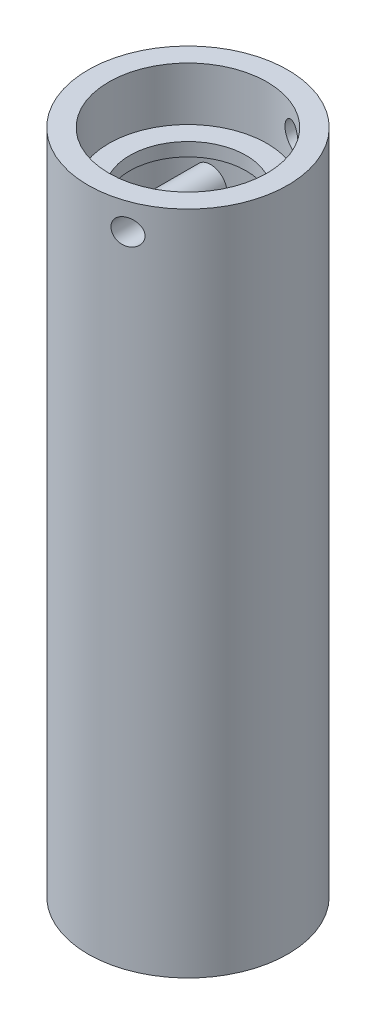
from build123d import *

# Parameters (mm, degrees)
SKETCH1_R                = 19.05
BOSS_EXTRUDE1_DEPTH      = 63.5
SKETCH2_R                = 14.2875
CUT_EXTRUDE1_DEPTH       = 114.3
SKETCH3_R                = 11.1125
CUT_EXTRUDE3_DEPTH       = 130.826056707
CUT_EXTRUDE5_DEPTH       = 130.826056707
CUT_EXTRUDE5_DEPTH_BACK  = 10.16
SKETCH4_R                = 15.08125
BOSS_EXTRUDE2_REACH      = 70.979
BOSS_EXTRUDE2_END_RADIUS = 15.08125
SKETCH6_R                = 3.175
CUT_EXTRUDE6_DEPTH       = 69.978656211
CUT_EXTRUDE6_DEPTH_BACK  = 69.978656211
SKETCH8_R                = 2.4
CUT_EXTRUDE7_DEPTH       = 130.826056834
CUT_EXTRUDE7_DEPTH_BACK  = 130.826056834
SKETCH9_W                = 6.35
SKETCH9_H                = 4.064


with BuildPart() as part:
    # Sketch1 → Boss-Extrude1 (new, symmetric)
    with BuildSketch(Plane(origin=(0, 0, 0), x_dir=(1, 0, 0), z_dir=(0, 1, 0))):
        Circle(SKETCH1_R)
    extrude(amount=BOSS_EXTRUDE1_DEPTH, both=True)

    # Sketch2 → Cut-Extrude1 (cut)
    with BuildSketch(Plane.XZ.offset(63.5)):
        Circle(SKETCH2_R)
    extrude(amount=-CUT_EXTRUDE1_DEPTH, mode=Mode.SUBTRACT)

    # Sketch3 → Cut-Extrude3 (cut, through all)
    with BuildSketch(Plane(origin=(0, 63.5, 0), x_dir=(1, 0, 0), z_dir=(0, 1, 0))):
        Circle(SKETCH3_R)
    extrude(amount=-CUT_EXTRUDE3_DEPTH, mode=Mode.SUBTRACT)

    # Sketch4 → Cut-Extrude5 (cut, two sides: drawn at the far end of the back side and taken through both)
    with BuildSketch(Plane(origin=(0, 63.5, 0), x_dir=(1, 0, 0), z_dir=(0, 1, 0)).offset(-CUT_EXTRUDE5_DEPTH_BACK)):
        Circle(SKETCH4_R)
    extrude(amount=CUT_EXTRUDE5_DEPTH + CUT_EXTRUDE5_DEPTH_BACK, mode=Mode.SUBTRACT)

    # Boss-Extrude2: up to this cylinder (the profile starts inside it)
    boss_extrude2_end = Plane(origin=(0, 58.42, 0), z_dir=(0, -1, 0)) * Cylinder(BOSS_EXTRUDE2_END_RADIUS, 173.1205, mode=Mode.PRIVATE)
    # Sketch6 → Boss-Extrude2 (add, up to the surface)
    with BuildSketch(Plane.XY, mode=Mode.PRIVATE) as boss_extrude2_sk1:
        with Locations((6.35, 58.42)):
            Circle(SKETCH6_R)
    boss_extrude2_tool1 = extrude(boss_extrude2_sk1.sketch, amount=BOSS_EXTRUDE2_REACH, mode=Mode.PRIVATE) & boss_extrude2_end
    add(boss_extrude2_tool1.solids().sort_by_distance((6.35, 58.42, 0))[0])

    # Sketch8 → Cut-Extrude6 (cut, two sides: drawn at the far end of the back side and taken through both)
    with BuildSketch(Plane.XY.offset(-CUT_EXTRUDE6_DEPTH_BACK)):
        with Locations((6.35, 58.42)):
            Circle(SKETCH8_R)
    extrude(amount=CUT_EXTRUDE6_DEPTH + CUT_EXTRUDE6_DEPTH_BACK, mode=Mode.SUBTRACT)

    # Sketch9 → Cut-Extrude7 (cut, two sides: drawn at the far end of the back side and taken through both)
    with BuildSketch(Plane(origin=(0, 63.5, 0), x_dir=(1, 0, 0), z_dir=(0, 1, 0)).offset(-CUT_EXTRUDE7_DEPTH_BACK)):
        with Locations((6.35, 0)):
            Rectangle(SKETCH9_W, SKETCH9_H)
    extrude(amount=CUT_EXTRUDE7_DEPTH + CUT_EXTRUDE7_DEPTH_BACK, mode=Mode.SUBTRACT)


solid = part.part
